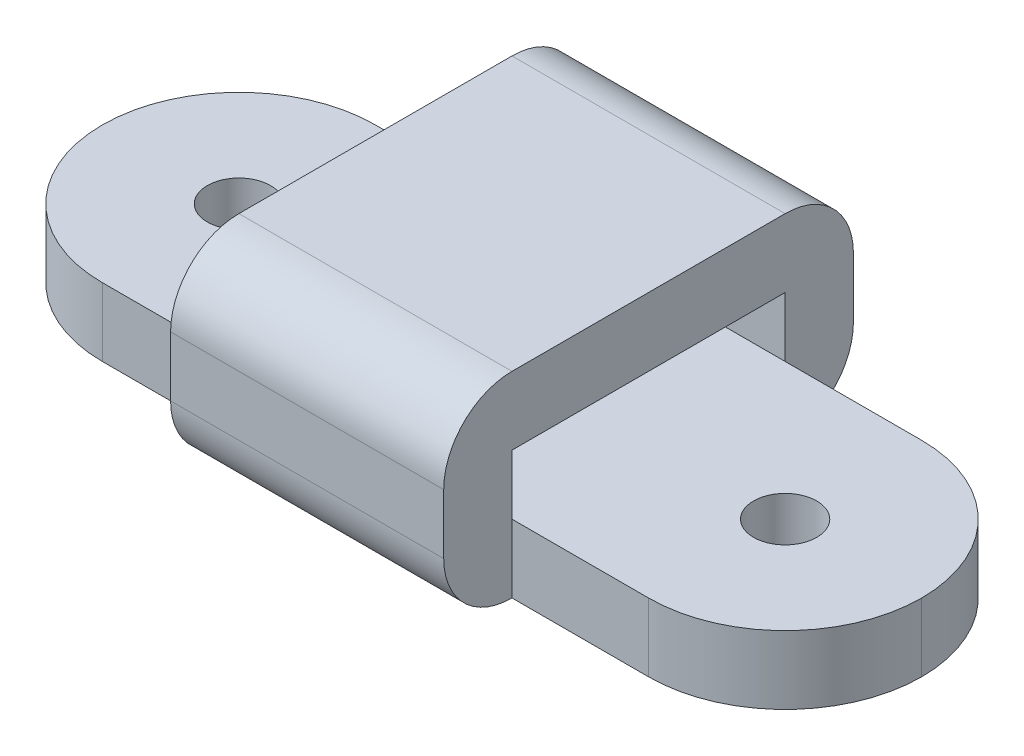
from build123d import *

# Parameters (mm, degrees)
SKETCH1_W           = 48
SKETCH1_H           = 16
SKETCH1_R           = 1.85
BOSS_EXTRUDE1_DEPTH = 4
BOSS_EXTRUDE2_DEPTH = 16
FILLET1_R           = 4
FILLET2_R           = 8


with BuildPart() as part:
    # Sketch1 → Boss-Extrude1 (new body)
    with BuildSketch(Plane(origin=(0, 0, 0), x_dir=(1, 0, 0), z_dir=(0, 1, 0))):
        Rectangle(SKETCH1_W, SKETCH1_H)
        with Locations(Location((-16, 0, 0), (0, 0, 270))):
            Circle(SKETCH1_R, mode=Mode.SUBTRACT)
        with Locations(Location((16, 0, 0), (0, 0, 270))):
            Circle(SKETCH1_R, mode=Mode.SUBTRACT)
    extrude(amount=BOSS_EXTRUDE1_DEPTH)

    # Sketch2 → Boss-Extrude2 (add)
    with BuildSketch(Plane.ZY.offset(8)):
        Polygon((-8, 4), (-8, 0), (-12, 0), (-12, 11.5), (12, 11.5), (12, 0), (8, 0), (8, 4), (8, 7.5), (-8, 7.5), align=None)
    extrude(amount=-BOSS_EXTRUDE2_DEPTH)

    # Fillet1
    fillet1_edges = [part.edges().sort_by_distance(p)[0] for p in [
        (0, 11.5, 12),
        (0, 0, 12),
        (0, 0, -12),
        (0, 11.5, -12),
    ]]
    fillet(fillet1_edges, radius=FILLET1_R)

    # Fillet2
    fillet2_edges = [part.edges().sort_by_distance(p)[0] for p in [
        (-24, 2, 8),
        (-24, 2, -8),
        (24, 2, 8),
        (24, 2, -8),
    ]]
    fillet(fillet2_edges, radius=FILLET2_R - 0.0001)  # a hair under: the kernel refuses the full size


solid = part.part
